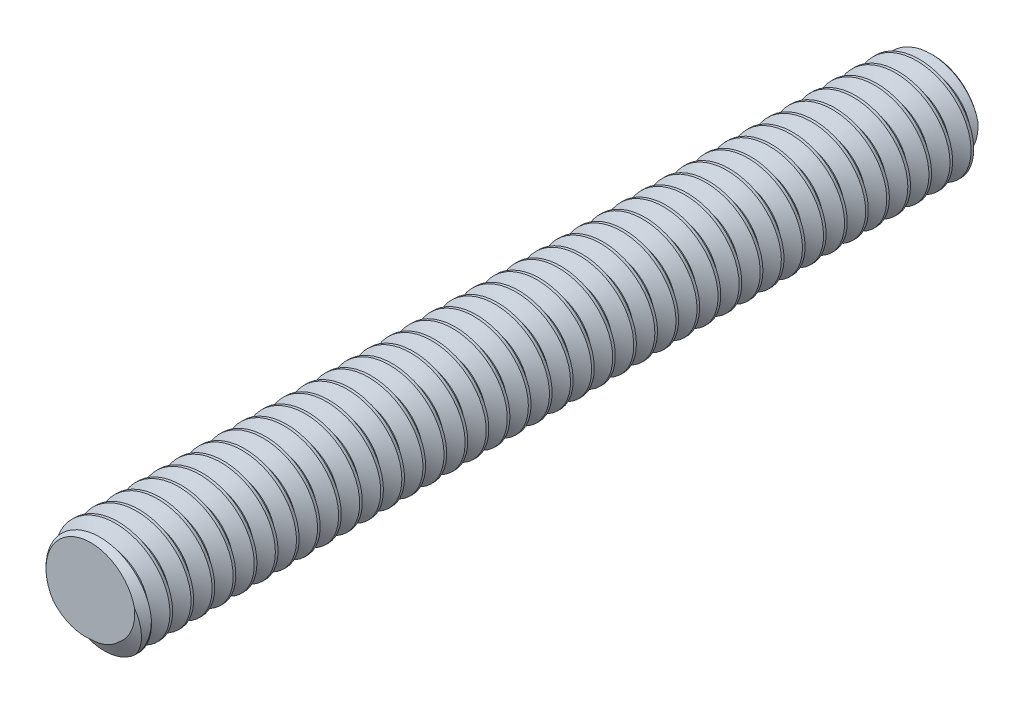
from build123d import *

# Parameters (mm, degrees)
BOSS_EXTRUDE1_DEPTH      = 25.4
BOSS_EXTRUDE1_DEPTH_BACK = 25.4
SKETCH2_R                = 3.175
CHAMFER1_SIZE            = 0.47625
CUT_SWEEP1_PITCH         = 1.27


with BuildPart() as part:
    # Sketch2 → Boss-Extrude1 (new, two sides: drawn at the far end of the back side and taken through both)
    with BuildSketch(Plane.XY.offset(-BOSS_EXTRUDE1_DEPTH_BACK)):
        Circle(SKETCH2_R)
    extrude(amount=BOSS_EXTRUDE1_DEPTH + BOSS_EXTRUDE1_DEPTH_BACK)

    # Chamfer1
    chamfer1_edges = [part.edges().sort_by_distance(p)[0] for p in [
        (-3.175, 0, -25.4),
        (-3.175, 0, 25.4),
    ]]
    chamfer(chamfer1_edges, length=CHAMFER1_SIZE)

    # Cut-Sweep1: arcs per turn and ends read off the stored shape
    # Cut-Sweep1: the profile of Sketch23 screwed along a right-hand helix through 50 turns, 8 arcs to a turn; built about Z, then put on its axis
    cut_sweep1_z = Axis((0, 0, 0), (0, 0, 1))
    cut_sweep1_corners = [(2.350110803, 0, -0.47625), (2.350110803, 0, -0.635), (3.243740766, 0, -1.1509375), (3.243740766, 0, 0.0396875)]
    with BuildLine(mode=Mode.PRIVATE) as cut_sweep1_profile:
        Line(cut_sweep1_corners[0], cut_sweep1_corners[1])
        Line(cut_sweep1_corners[1], cut_sweep1_corners[2])
        Line(cut_sweep1_corners[2], cut_sweep1_corners[3])
        Line(cut_sweep1_corners[3], cut_sweep1_corners[0])
    cut_sweep1_cap = Face(cut_sweep1_profile.wire())
    cut_sweep1_turn_angles = [0, 22.5, 45, 67.5, 90, 112.5, 135, 157.5, 180, 202.5, 225, 247.5, 270, 292.5, 315, 337.5, 360]
    cut_sweep1_turn_weights = [1, 0.9238795325112867, 1, 0.9238795325112867, 1, 0.9238795325112867, 1, 0.9238795325112867, 1, 0.9238795325112867, 1, 0.9238795325112867, 1, 0.9238795325112867, 1, 0.9238795325112867, 1]
    cut_sweep1_turn_rails = [Edge.make_bspline([Vector(p[0], p[1], 0).rotate(cut_sweep1_z, cut_sweep1_turn_angles[k]) / cut_sweep1_turn_weights[k] + Vector(0, 0, p[2] + CUT_SWEEP1_PITCH * cut_sweep1_turn_angles[k] / 360) for k in range(17)], [0, 0, 0, 1, 1, 2, 2, 3, 3, 4, 4, 5, 5, 6, 6, 7, 7, 8, 8, 8], 2, cut_sweep1_turn_weights) for p in cut_sweep1_corners]
    cut_sweep1_turn_sides = [Face.make_surface_from_curves(cut_sweep1_turn_rails[p[0]], cut_sweep1_turn_rails[p[1]]) for p in [(0, 1), (1, 2), (2, 3), (3, 0)]]
    cut_sweep1 = Plane(origin=(0, 0, 25.4), x_dir=(0, 1, 0), z_dir=(0, 0, -1)) * Solid(Shell([*[p.moved(Location((0, 0, CUT_SWEEP1_PITCH * i))) for i in range(50) for p in cut_sweep1_turn_sides], cut_sweep1_cap, cut_sweep1_cap.rotate(cut_sweep1_z, 18000).moved(Location((0, 0, CUT_SWEEP1_PITCH * 18000 / 360)))]))
    add(cut_sweep1, mode=Mode.SUBTRACT)


solid = part.part
